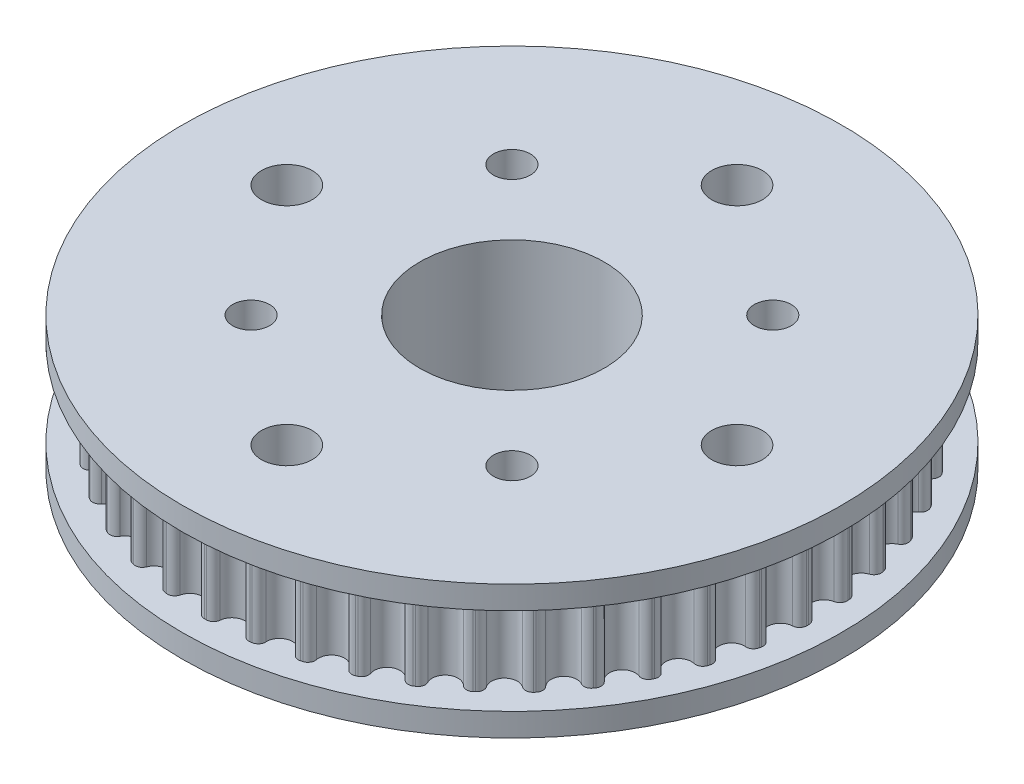
from build123d import *
from build123d.topology import SkipClean

# Parameters (mm, degrees)
BOSS_EXTRUDE1_DEPTH     = 3
CIRPATTERN1_COUNT       = 45
SKETCH2_W               = 16.342208267
SKETCH2_H               = 1.5875
CUT_EXTRUDE1_DEPTH      = 33.976397443
CUT_EXTRUDE1_DEPTH_BACK = 33.976397443
SKETCH3_R               = 1.74625
SKETCH3_R_2             = 6.35
SKETCH3_R_3             = 1.27


with BuildPart() as part:
    # Sketch1 → Boss-Extrude1 (new, symmetric)
    with BuildSketch(Plane(origin=(0, 0, 0), x_dir=(1, 0, 0), z_dir=(0, 1, 0))):
        with BuildLine():
            ThreePointArc((0, 19.884811005), (0.578412474, 20.098394706), (0.879208145, 20.636633455))
            ThreePointArc((0.879208145, 20.636633455), (1.061044452, 20.949637237), (1.406466311, 21.057894109))
            ThreePointArc((1.406466311, 21.057894109), (1.472197202, 21.053400846), (1.537913746, 21.048702409))
            ThreePointArc((1.537913746, 21.048702409), (1.864907538, 20.893425655), (2.00141252, 20.558161281))
            ThreePointArc((2.00141252, 20.558161281), (2.224372512, 19.983297968), (2.76743081, 19.691293391))
            ThreePointArc((2.76743081, 19.691293391), (-1.387094297, -19.836372605), (0, 19.884811005))
        make_face()
    boss_extrude1 = extrude(amount=BOSS_EXTRUDE1_DEPTH, both=True)

    # CirPattern1: Boss-Extrude1 ×45 about axis
    cirpattern1_axis = Axis((0, 3.3, 0), (0, -1, 0))
    for i in range(1, CIRPATTERN1_COUNT):
        add(boss_extrude1.rotate(cirpattern1_axis, i * 360 / CIRPATTERN1_COUNT))

    # Sketch2 → Revolve3 (revolve)
    with BuildSketch(Plane(origin=(0, 0, 0), x_dir=(0, 0, -1), z_dir=(1, 0, 0))):
        with Locations((14.521104134, 3.79375)):
            Rectangle(SKETCH2_W, SKETCH2_H)
    revolve3 = revolve(axis=Axis((0, 3.3, 0), (0, -1, 0)))

    # Mirror1: Revolve3 across plane
    add(revolve3.mirror(Plane.ZX))

    # Sketch3 → Cut-Extrude1 (cut, two sides: drawn at the far end of the back side and taken through both)
    with SkipClean():  # the faces are left unmerged after this step: merging them gives an invalid solid
        with BuildSketch(Plane(origin=(0, 3, 0), x_dir=(1, 0, 0), z_dir=(0, 1, 0)).offset(-CUT_EXTRUDE1_DEPTH_BACK)):
            with Locations((-15.5, 0)):
                Circle(SKETCH3_R)
            Circle(SKETCH3_R_2)
            with Locations((0, 15.5)):
                Circle(SKETCH3_R)
            with Locations((15.5, 0)):
                Circle(SKETCH3_R)
            with Locations((0, -15.5)):
                Circle(SKETCH3_R)
            with Locations((-8.980256121, 8.980256121)):
                Circle(SKETCH3_R_3)
            with Locations((8.980256121, 8.980256121)):
                Circle(SKETCH3_R_3)
            with Locations((8.980256121, -8.980256121)):
                Circle(SKETCH3_R_3)
            with Locations((-8.980256121, -8.980256121)):
                Circle(SKETCH3_R_3)
        extrude(amount=CUT_EXTRUDE1_DEPTH + CUT_EXTRUDE1_DEPTH_BACK, mode=Mode.SUBTRACT)


solid = part.part
